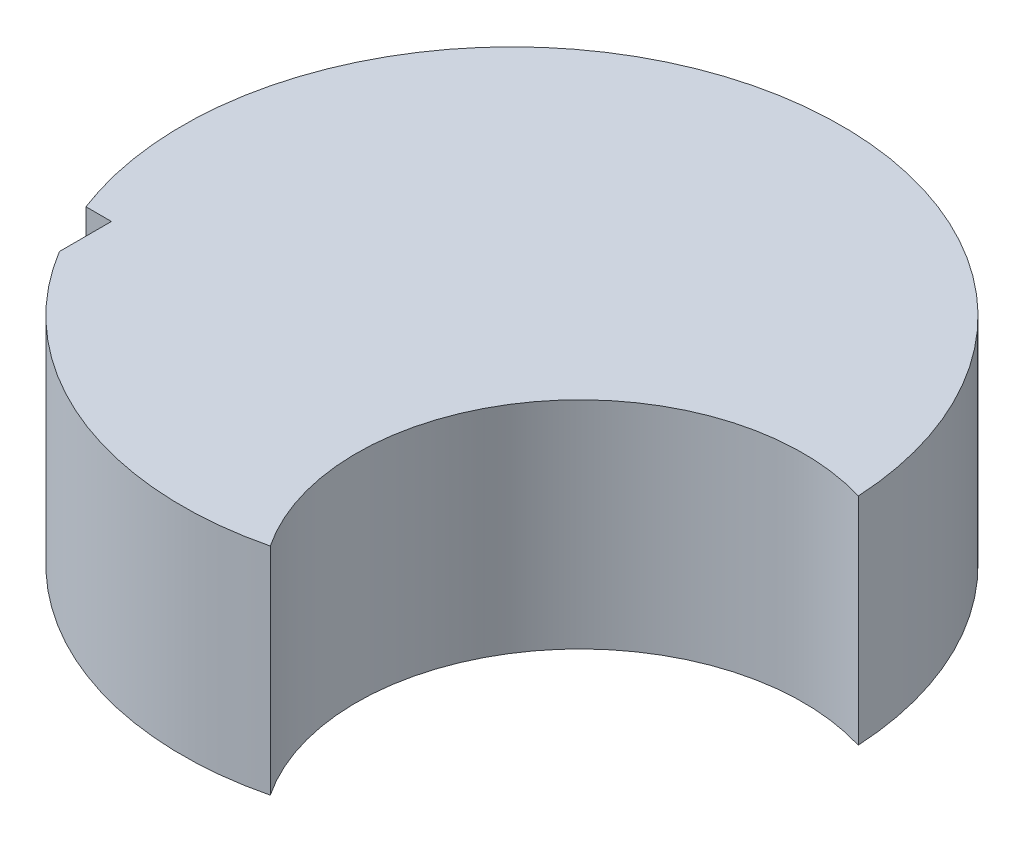
from build123d import *

# Parameters (mm, degrees)
BOSS_EXTRUDE1_DEPTH = 60.96
CUT_EXTRUDE1_REACH  = 147.095
SKETCH3_W           = 40.961637843
SKETCH3_H           = 33.750081885


with BuildPart() as part:
    # Sketch1 → Boss-Extrude1 (new body)
    with BuildSketch(Plane(origin=(0, 0, 0), x_dir=(1, 0, 0), z_dir=(0, 1, 0))):
        with BuildLine():
            ThreePointArc((92.976117224, 4.860881604), (-74.724124634, 55.538200742), (22.152321734, -90.429315965))
            ThreePointArc((22.152321734, -90.429315965), (24.083056487, -17.899569011), (92.976117224, 4.860881604))
        make_face()
    extrude(amount=BOSS_EXTRUDE1_DEPTH)

    # Sketch3 → Cut-Extrude1 (cut, up to next)
    with BuildSketch(Plane(origin=(0, 60.96, 0), x_dir=(1, 0, 0), z_dir=(0, 1, 0)), mode=Mode.PRIVATE) as cut_extrude1_sk1:
        with Locations((-100.15988625, -50.336660589)):
            Rectangle(SKETCH3_W, SKETCH3_H)
    cut_extrude1_tool1 = extrude(cut_extrude1_sk1.sketch, amount=-CUT_EXTRUDE1_REACH, mode=Mode.PRIVATE) & part.part
    add(cut_extrude1_tool1.solids().sort_by_distance((-100.159886, 60.96, 50.336661))[0], mode=Mode.SUBTRACT)


solid = part.part
